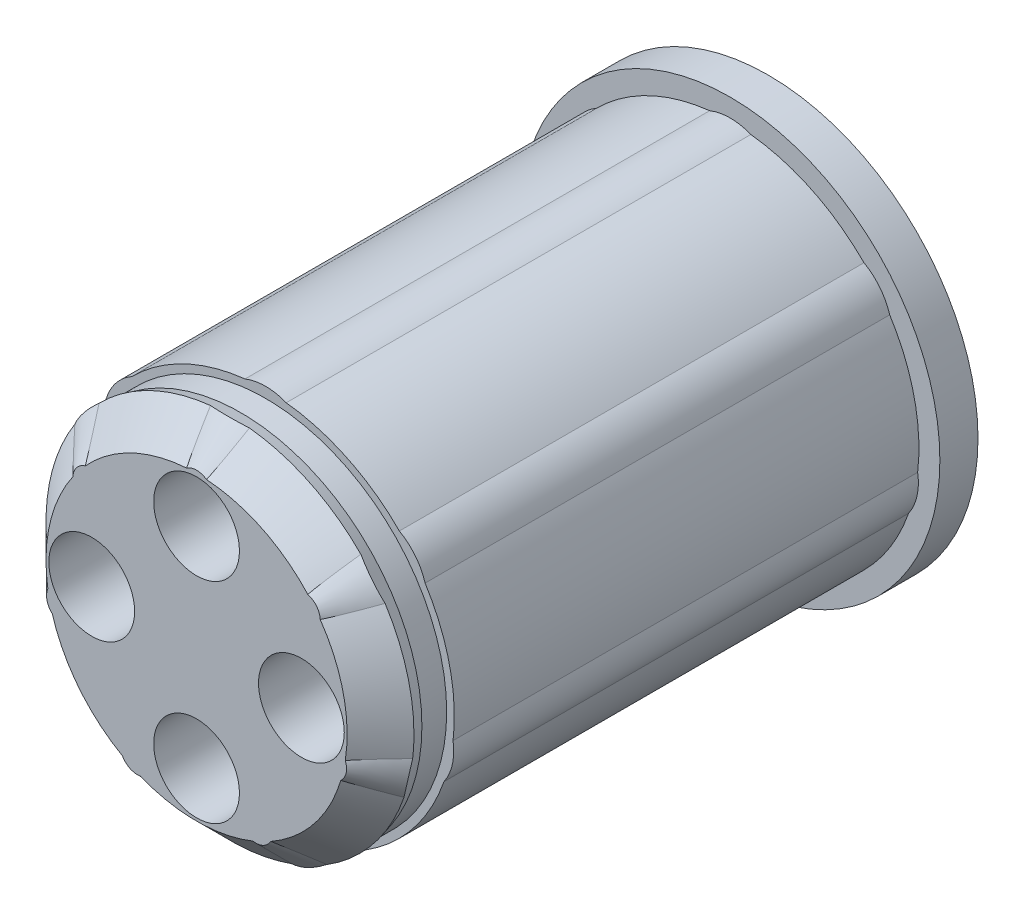
from build123d import *

# Parameters (mm, degrees)
AUFSATZ_LINEAR_AUSTRAGEN1_DEPTH      = 30
SKIZZE2_R                            = 11
AUFSATZ_LINEAR_AUSTRAGEN2_DEPTH      = 2
FASE1_SIZE                           = 2
SCHNITT_LINEAR_AUSTRAGEN1_DEPTH      = 33.031234844
SCHNITT_LINEAR_AUSTRAGEN1_DEPTH_BACK = 33.031234844
SKIZZE3_R                            = 2.25


with BuildPart() as part:
    # Skizze1 → Aufsatz-Linear austragen1 (new body)
    with BuildSketch(Plane.XY):
        with BuildLine():
            ThreePointArc((9.834694469, -1.13524654), (9.651786331, 2.202957246), (8.368188528, 5.289935799))
            ThreePointArc((8.368188528, 5.289935799), (7.857406399, 6.266072509), (7.019403191, 6.981259116))
            ThreePointArc((7.019403191, 6.981259116), (4.295449017, 8.919591792), (1.081641859, 9.840734266))
            ThreePointArc((1.081641859, 9.840734266), (0, 10.05), (-1.081641859, 9.840734266))
            ThreePointArc((-1.081641859, 9.840734266), (-4.295449017, 8.919591792), (-7.019403191, 6.981259116))
            ThreePointArc((-7.019403191, 6.981259116), (-7.857406399, 6.266072509), (-8.368188528, 5.289935799))
            ThreePointArc((-8.368188528, 5.289935799), (-9.651786331, 2.202957246), (-9.834694469, -1.13524654))
            ThreePointArc((-9.834694469, -1.13524654), (-9.798025517, -2.236335386), (-9.353318555, -3.244292219))
            ThreePointArc((-9.353318555, -3.244292219), (-7.740131676, -6.172549038), (-5.24426022, -8.396888397))
            ThreePointArc((-5.24426022, -8.396888397), (-4.360531578, -9.054737122), (-3.295208938, -9.335502025))
            ThreePointArc((-3.295208938, -9.335502025), (0, -9.9), (3.295208938, -9.335502025))
            ThreePointArc((3.295208938, -9.335502025), (4.360531578, -9.054737122), (5.24426022, -8.396888397))
            ThreePointArc((5.24426022, -8.396888397), (7.740131676, -6.172549038), (9.353318555, -3.244292219))
            ThreePointArc((9.353318555, -3.244292219), (9.798025517, -2.236335386), (9.834694469, -1.13524654))
        make_face()
    extrude(amount=AUFSATZ_LINEAR_AUSTRAGEN1_DEPTH)

    # Skizze2 → Aufsatz-Linear austragen2 (add)
    with BuildSketch(Plane.XY):
        Circle(SKIZZE2_R)
    extrude(amount=AUFSATZ_LINEAR_AUSTRAGEN2_DEPTH)

    # Fase1
    fase1_edges = [part.edges().sort_by_distance(p)[0] for p in [
        (9.798025517, -2.236335386, 30),
        (7.740131676, -6.172549038, 30),
        (4.360531578, -9.054737122, 30),
        (0, -9.9, 30),
        (-4.360531578, -9.054737122, 30),
        (-7.740131676, -6.172549038, 30),
        (-9.798025517, -2.236335386, 30),
        (-9.651786331, 2.202957246, 30),
        (-7.857406399, 6.266072509, 30),
        (-4.295449017, 8.919591792, 30),
        (0, 10.05, 30),
        (4.295449017, 8.919591792, 30),
        (7.857406399, 6.266072509, 30),
        (9.651786331, 2.202957246, 30),
    ]]
    chamfer(fase1_edges, length=FASE1_SIZE)

    # Skizze3 → Schnitt-Linear austragen1 (cut, two sides: drawn at the far end of the back side and taken through both)
    with BuildSketch(Plane.XY.offset(2).offset(-SCHNITT_LINEAR_AUSTRAGEN1_DEPTH_BACK)):
        with Locations((0, 5.5)):
            Circle(SKIZZE3_R)
        with Locations((5.5, 0)):
            Circle(SKIZZE3_R)
        with Locations((0, -5.5)):
            Circle(SKIZZE3_R)
        with Locations((-5.5, 0)):
            Circle(SKIZZE3_R)
    extrude(amount=SCHNITT_LINEAR_AUSTRAGEN1_DEPTH + SCHNITT_LINEAR_AUSTRAGEN1_DEPTH_BACK, mode=Mode.SUBTRACT)

    # Skizze4 → Schnitt-Rotation1 (revolve, cut)
    with BuildSketch(Plane(origin=(0, 0, 0), x_dir=(0, 0, -1), z_dir=(1, 0, 0))):
        Polygon((-27.676581368, 10.05), (-26.376581368, 10.05), (-26.376581368, 9.5), (-27.676581368, 9.5), (-29.729209312, 10.05), align=None)
    revolve(axis=Axis((0, 0, 0), (0, 0, -1)), mode=Mode.SUBTRACT)


solid = part.part
